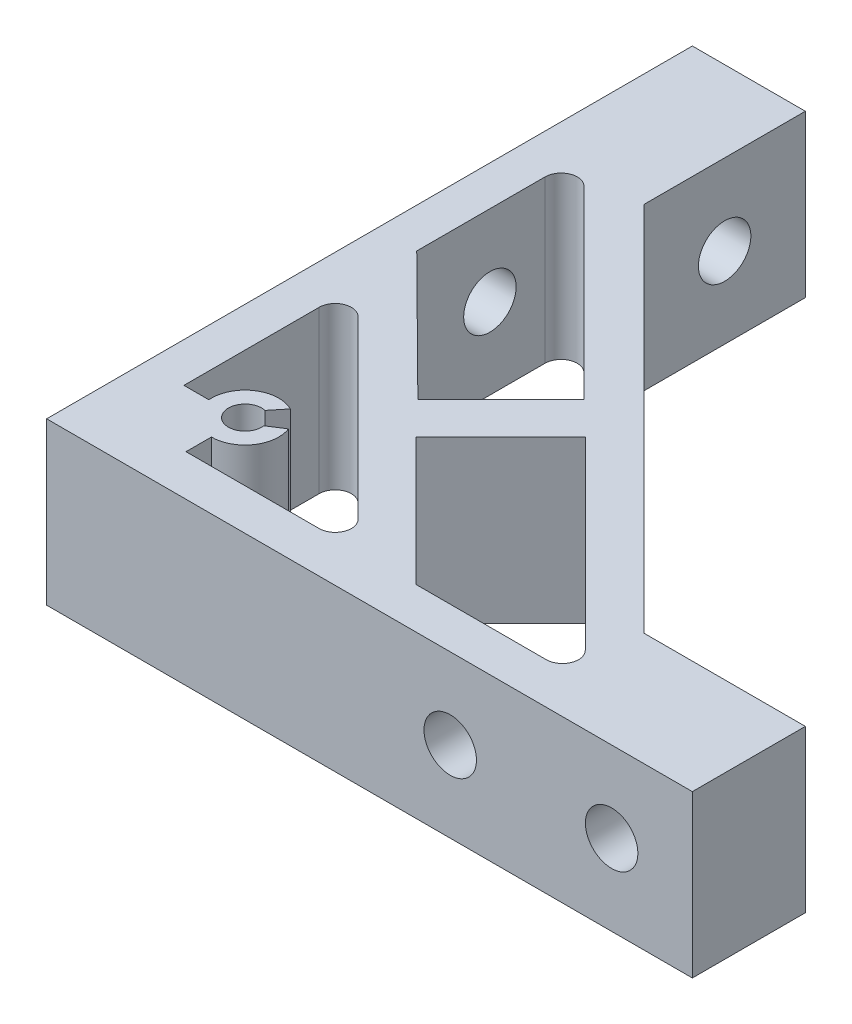
from build123d import *

# Parameters (mm, degrees)
EXTRUDE_1_DEPTH     = 20
SKETCH_2_R          = 3.25
CUT_EXTRUDE_1_DEPTH = 115.891252931
SKETCH_3_R          = 3.25
CUT_EXTRUDE_2_DEPTH = 115.891252931
CUT_EXTRUDE_3_DEPTH = 115.891252931
SKETCH_7_R          = 5.5
CUT_EXTRUDE_4_DEPTH = 25
SKETCH_8_R          = 5.5
CUT_EXTRUDE_5_DEPTH = 25


with BuildPart() as part:
    # 草图1 → 凸台-拉伸1 (new body)
    with BuildSketch(Plane(origin=(0, 0, 0), x_dir=(1, 0, 0), z_dir=(0, 1, 0))):
        Polygon((0, 80), (0, 0), (80, 0), (80, 14), (60, 14), (14, 60), (14, 80), align=None)
    extrude(amount=EXTRUDE_1_DEPTH)

    # 草图2 → 切除-拉伸1 (cut, through all)
    with BuildSketch(Plane.ZY):
        with Locations((-70, 10)):
            Circle(SKETCH_2_R)
        with Locations((-50, 10)):
            Circle(SKETCH_2_R)
    extrude(amount=-CUT_EXTRUDE_1_DEPTH, mode=Mode.SUBTRACT)

    # 草图3 → 切除-拉伸2 (cut, through all)
    with BuildSketch(Plane.XY):
        with Locations((70, 10)):
            Circle(SKETCH_3_R)
        with Locations((50, 10)):
            Circle(SKETCH_3_R)
    extrude(amount=-CUT_EXTRUDE_2_DEPTH, mode=Mode.SUBTRACT)

    # 草图4 → 切除-拉伸3 (cut, through all)
    with BuildSketch(Plane.XZ):
        with BuildLine():
            Line((20.901080392, -25.090385961), (31.191934333, -35.381239902))
            Line((31.191934333, -35.381239902), (8.330781791, -58.242392444))
            ThreePointArc((8.330781791, -58.242392444), (6.151201363, -58.675937947), (4.916568228, -56.828178882))
            Line((4.916568228, -56.828178882), (4.916568228, -40.934892559))
            Line((4.916568228, -40.934892559), (20.901080392, -25.090385961))
        make_face()
        with BuildLine():
            Line((24.837924499, -20.930281625), (35.319025282, -31.411382408))
            Line((35.319025282, -31.411382408), (58.210769263, -8.519638426))
            ThreePointArc((58.210769263, -8.519638426), (58.644314766, -6.340057999), (56.796555701, -5.105424864))
            Line((56.796555701, -5.105424864), (40.662781261, -5.105424864))
            Line((40.662781261, -5.105424864), (24.837924499, -20.930281625))
        make_face()
        with BuildLine():
            Line((12.160826912, -5.105424864), (28.651360093, -5.105424864))
            ThreePointArc((28.651360093, -5.105424864), (30.499119158, -6.340057999), (30.065573655, -8.519638426))
            Line((30.065573655, -8.519638426), (8.330781791, -30.254430291))
            ThreePointArc((8.330781791, -30.254430291), (6.151201363, -30.687975793), (4.916568228, -28.840216728))
            Line((4.916568228, -28.840216728), (4.916568228, -12.090508469))
            Line((4.916568228, -12.090508469), (8.000520281, -12.090508469))
            ThreePointArc((8.000520281, -12.090508469), (9.82829842, -15.883616127), (14.030107382, -16.154245149))
            Line((14.030107382, -16.154245149), (12.625484958, -14.430268904))
            ThreePointArc((12.625484958, -14.430268904), (10.638085741, -11.03439689), (14.202657003, -12.700390319))
            Line((14.202657003, -12.700390319), (16.06551283, -13.896467584))
            ThreePointArc((16.06551283, -13.896467584), (15.593703645, -10.049139087), (12.160826912, -8.249167474))
            Line((12.160826912, -8.249167474), (12.160826912, -5.105424864))
        make_face()
    extrude(amount=-CUT_EXTRUDE_3_DEPTH, mode=Mode.SUBTRACT)

    # 草图7 → 切除-拉伸4 (cut)
    with BuildSketch(Plane.XY.offset(-35)):
        with Locations((50, 10)):
            Circle(SKETCH_7_R)
    extrude(amount=CUT_EXTRUDE_4_DEPTH, mode=Mode.SUBTRACT)

    # 草图8 → 切除-拉伸5 (cut)
    with BuildSketch(Plane(origin=(35, 0, 0), x_dir=(0, 0, -1), z_dir=(1, 0, 0))):
        with Locations((50, 10)):
            Circle(SKETCH_8_R)
    extrude(amount=-CUT_EXTRUDE_5_DEPTH, mode=Mode.SUBTRACT)


solid = part.part
